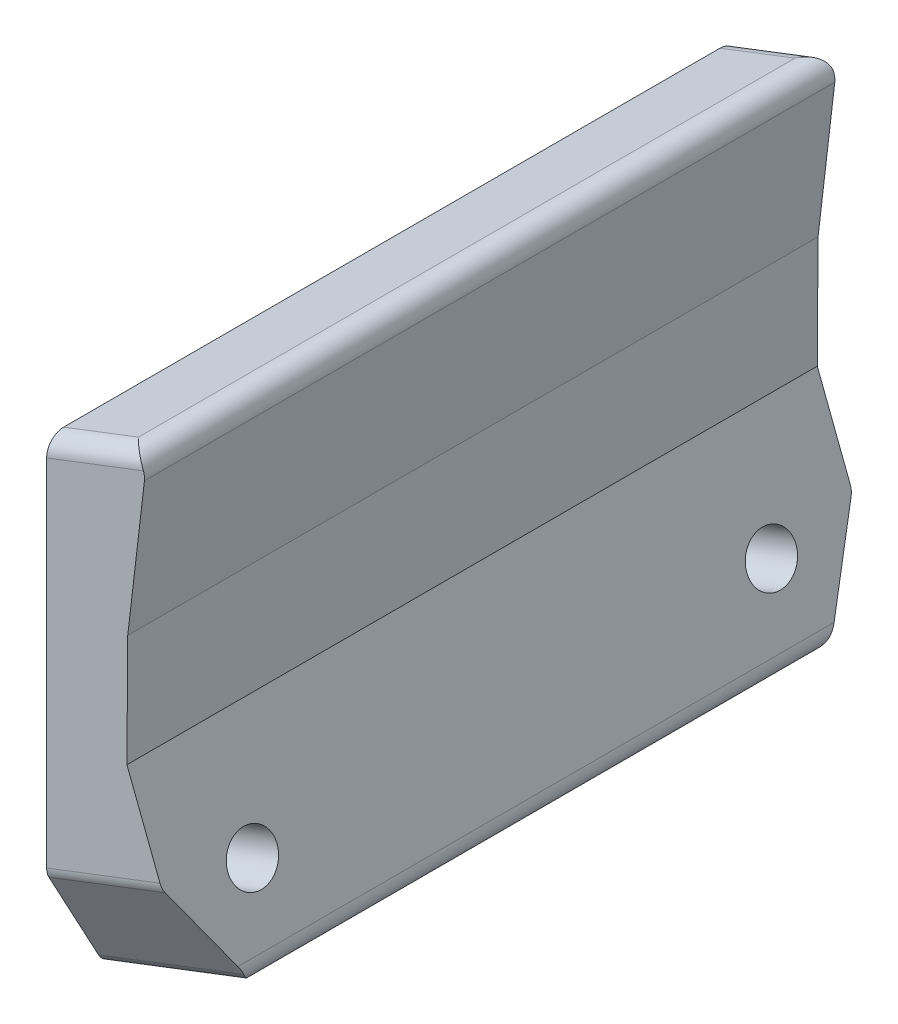
from build123d import *

# Parameters (mm, degrees)
EXTRUDE_L_DEPTH        = 40.640000266
SKETCH_506_R           = 1.642286764
EXTRUDE_A_DEPTH        = 8.205424
SKETCH_6_R             = 1.647216999
EXTRUDE_B_DEPTH        = 8.205424
SKETCH_66_R            = 2.75
CUT_EXTRUDE_2755_DEPTH = 51.448100318
CUT_EXTRUDE_2790_REACH = 51.787
FILLET_3_R             = 1


with BuildPart() as part:
    # 主L型: read off the stored shape, not the designer's step
    # 主L型 outline → 主L型 (new body)
    with BuildSketch(Plane.XY):
        Polygon((0, 28.473390503), (0, 0), (8.845423506, 3.395440187), (4.726521328, 14.125546488), (4.773897119, 20.740741864), (5.951057155, 30.762189648), align=None)
    extrude(amount=EXTRUDE_L_DEPTH)

    # Sketch 506 → 螺丝台A (add)
    with BuildSketch(Plane(origin=(8.845423506, 3.395440187, 0), x_dir=(0, 0, -1), z_dir=(0.9335804184498224, 0.3583679705094393, 0))):
        with Locations((-5.045565417, 4.946234453)):
            Circle(SKETCH_506_R)
    extrude(amount=-EXTRUDE_A_DEPTH)

    # 螺丝穿出面<6> → 螺丝台B (add)
    with BuildSketch(Plane(origin=(8.845423506, 3.395440187, 0), x_dir=(0, 0, -1), z_dir=(0.9335804184498224, 0.3583679705094393, 0))):
        with Locations((-35.594637562, 4.953875303)):
            Circle(SKETCH_6_R)
    extrude(amount=-EXTRUDE_B_DEPTH)

    # 草图64 → 螺丝A M2.5 凹头盖螺钉的柱形沉头孔14 (revolve, cut)
    with BuildSketch(Plane(origin=(-0.587571577, 5.072586706, 5.045565417), x_dir=(0.3583679705094393, -0.9335804184498224, 0), z_dir=(0, 0, 1))):
        Polygon((0, 0), (0, 18.012790366), (1.45, 18.012790366), (1.45, 2.5), (2.75, 2.5), (2.75, 0.025), (2.775, 0), align=None)
    revolve(axis=Axis((-6.515807234, 2.796950093, 5.045565417), (0.9335804184498225, 0.3583679705094394, 0)), mode=Mode.SUBTRACT)

    # 草图65 → 螺丝B M2.5 凹头盖螺钉的柱形沉头孔15 (revolve, cut)
    with BuildSketch(Plane(origin=(-0.590309813, 5.079720054, 35.594637562), x_dir=(0.3583679705094393, -0.9335804184498224, 0), z_dir=(0, 0, 1))):
        Polygon((0, 0), (0, 18.012790366), (1.45, 18.012790366), (1.45, 2.5), (2.75, 2.5), (2.75, 0.025), (2.775, 0), align=None)
    revolve(axis=Axis((-6.51854547, 2.804083441, 35.594637562), (0.9335804184498225, 0.35836797050943936, 0)), mode=Mode.SUBTRACT)

    # 草图66 → Cut-Extrude 2755 (cut, through all)
    with BuildSketch(Plane(origin=(3.518951472, 1.350799002, 0), x_dir=(0, 0, 1), z_dir=(-0.9335804184498225, -0.3583679705094393, 0))):
        with Locations(Location((5.045565417, 4.946234453, 0), (0, 0, 270))):
            Circle(SKETCH_66_R)
        with Locations(Location((35.594637562, 4.953875303, 0), (0, 0, 270))):
            Circle(SKETCH_66_R)
    extrude(amount=CUT_EXTRUDE_2755_DEPTH, mode=Mode.SUBTRACT)

    # Cut-Extrude 2790: up to this plane
    cut_extrude_2790_end = Plane(origin=(0, 28.473390503, 72.648652673), z_dir=(1, 0, 0))
    # 螺丝穿出面<7> → Cut-Extrude 2790 (cut, up to the surface)
    with BuildSketch(Plane(origin=(8.845423506, 3.395440187, 0), x_dir=(0, 0, -1), z_dir=(0.9335804184498224, 0.3583679705094393, 0)), mode=Mode.PRIVATE) as cut_extrude_2790_sk1:
        Polygon((0, 5.796717469), (-3.346571729, 0), (0, 0), align=None)
    cut_extrude_2790_tool1 = split(extrude(cut_extrude_2790_sk1.sketch, amount=-CUT_EXTRUDE_2790_REACH, mode=Mode.PRIVATE), bisect_by=cut_extrude_2790_end, keep=Keep.BOTH, mode=Mode.PRIVATE)
    cut_extrude_2790 = cut_extrude_2790_tool1.solids().sort_by_distance((8.152971, 5.199341, 1.115524))[0]
    add(cut_extrude_2790, mode=Mode.SUBTRACT)

    # 镜向6: Cut-Extrude 2790 across plane
    add(cut_extrude_2790.mirror(Plane(origin=(0, 0, 20.320000133), x_dir=(1, 0, 0), z_dir=(0, 0, -1))), mode=Mode.SUBTRACT)

    # 圆角3
    fillet_3_edges = [part.edges().sort_by_distance(p)[0] for p in [
        (5.951057155, 30.762189648, 20.320000133),
        (2.975528577, 29.617790076, 0),
        (2.975528577, 29.617790076, 40.640000266),
        (4.422711753, 1.697720093, 3.346571729),
        (3.384032816, 7.508133528, 0),
        (8.845423506, 3.395440187, 20.320000133),
        (3.384032816, 7.508133528, 40.640000266),
        (4.422711753, 1.697720093, 37.293428537),
    ]]
    fillet(fillet_3_edges, radius=FILLET_3_R)


solid = part.part
